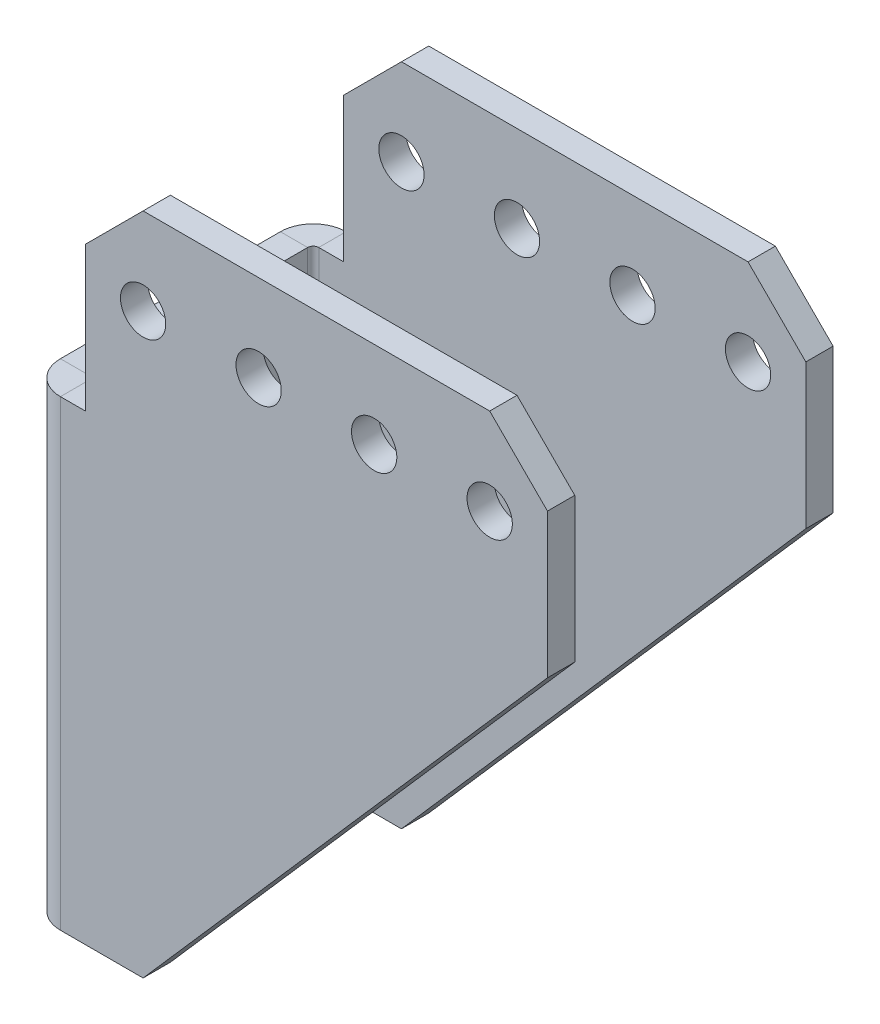
from build123d import *

# Parameters (mm, degrees)
SKETCH7_W                  = 50.8
SKETCH7_H                  = 24.1808
BASE_FLANGE1_DEPTH         = 3
F_9_0_196_DIAMETER_HOLE1_D = 4.9784
EDGE_FLANGE1_DEPTH         = 50.8
EDGE_FLANGE1_START         = 3
EDGE_FLANGE1_PROFILE_R     = 2.4892
EDGE_FLANGE1_FLAT_DEPTH    = 3
EDGE_FLANGE2_DEPTH         = 50.8
EDGE_FLANGE2_START         = 3
EDGE_FLANGE2_PROFILE_R     = 2.4892
EDGE_FLANGE2_FLAT_DEPTH    = 3


# Sheet-metal steps are written as plain solids
with BuildPart() as part:
    # Sketch7 → Base-Flange1 (new body)
    with BuildSketch(Plane(origin=(0, 0, 0), x_dir=(0, -1, 0), z_dir=(-1, 0, 0))):
        with Locations((-25.4, -15.7)):
            Rectangle(SKETCH7_W, SKETCH7_H)
    extrude(amount=-BASE_FLANGE1_DEPTH)

    # #9 (0.196) Diameter Hole1 (through all)
    with Locations(Plane(origin=(3, 0, 0), x_dir=(0, 0, -1), z_dir=(1, 0, 0))):
        with Locations((15.7, 25.4), (15.7, 12.7), (15.7, 38.1)):
            Hole(F_9_0_196_DIAMETER_HOLE1_D / 2)

    # Edge-Flange1 bend section (across the edge) → Edge-Flange1 (add)
    with BuildSketch(Plane(origin=(3, 0, -28.4), x_dir=(0, 0, 1), z_dir=(0, 1, 0))):
        with BuildLine():
            Line((-3, 0.6096), (0, 0.6096))
            ThreePointArc((0, 0.6096), (0.178547706, 0.178547706), (0.6096, 0))
            Line((0.6096, 0), (0.6096, -3))
            ThreePointArc((0.6096, -3), (-1.942772637, -1.942772637), (-3, 0.6096))
        make_face()
    extrude(amount=EDGE_FLANGE1_DEPTH)

    # Edge-Flange1 profile (on flange) → Edge-Flange1 flat (add)
    with BuildSketch(Plane(origin=(3, 0, -28.4), x_dir=(0, 1, 0), z_dir=(0, 0, -1)).offset(EDGE_FLANGE1_START)):
        Polygon((0, 0.6096), (50.8, 0.6096), (50.8, 3.35), (66.675, 3.35), (73.025, 9.7), (73.025, 47.8), (66.675, 54.15), (50.8, 54.15), (0, 9.7), align=None)
        with Locations((63.5, 9.7)):
            Circle(EDGE_FLANGE1_PROFILE_R, mode=Mode.SUBTRACT)
        with Locations((63.5, 22.4)):
            Circle(EDGE_FLANGE1_PROFILE_R, mode=Mode.SUBTRACT)
        with Locations((63.5, 35.1)):
            Circle(EDGE_FLANGE1_PROFILE_R, mode=Mode.SUBTRACT)
        with Locations((63.5, 47.8)):
            Circle(EDGE_FLANGE1_PROFILE_R, mode=Mode.SUBTRACT)
    extrude(amount=-EDGE_FLANGE1_FLAT_DEPTH)

    # Edge-Flange2 bend section (across the edge) → Edge-Flange2 (add)
    with BuildSketch(Plane(origin=(3, 50.8, -3), x_dir=(0, 0, -1), z_dir=(0, -1, 0))):
        with BuildLine():
            Line((-3, 0.6096), (0, 0.6096))
            ThreePointArc((0, 0.6096), (0.178547706, 0.178547706), (0.6096, 0))
            Line((0.6096, 0), (0.6096, -3))
            ThreePointArc((0.6096, -3), (-1.942772637, -1.942772637), (-3, 0.6096))
        make_face()
    extrude(amount=EDGE_FLANGE2_DEPTH)

    # Edge-Flange2 profile (on flange) → Edge-Flange2 flat (add)
    with BuildSketch(Plane(origin=(3, 0, -3), x_dir=(0, -1, 0), z_dir=(0, 0, 1)).offset(EDGE_FLANGE2_START)):
        Polygon((0, 0.6096), (0, 9.7), (-50.8, 54.15), (-66.675, 54.15), (-73.025, 47.8), (-73.025, 9.7), (-66.675, 3.35), (-50.8, 3.35), (-50.8, 0.6096), align=None)
        with Locations((-63.5, 9.7)):
            Circle(EDGE_FLANGE2_PROFILE_R, mode=Mode.SUBTRACT)
        with Locations((-63.5, 22.4)):
            Circle(EDGE_FLANGE2_PROFILE_R, mode=Mode.SUBTRACT)
        with Locations((-63.5, 35.1)):
            Circle(EDGE_FLANGE2_PROFILE_R, mode=Mode.SUBTRACT)
        with Locations((-63.5, 47.8)):
            Circle(EDGE_FLANGE2_PROFILE_R, mode=Mode.SUBTRACT)
    extrude(amount=-EDGE_FLANGE2_FLAT_DEPTH)


solid = part.part
